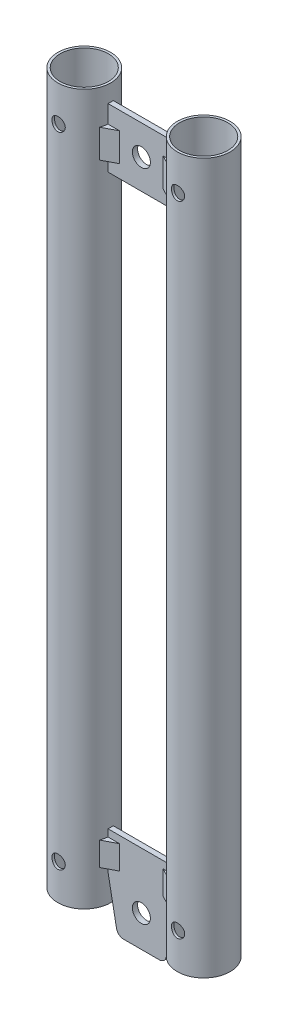
from build123d import *

# Parameters (mm, degrees)
SKETCH1_R                = 3.8
BOSS_EXTRUDE1_DEPTH      = 1.1
SKETCH1_W                = 28
SKETCH1_H                = 25
BOSS_EXTRUDE1_2_DEPTH    = 1.1
BOSS_EXTRUDE2_DEPTH      = 295.2
BOSS_EXTRUDE2_DEPTH_BACK = 3.8
SKETCH2_R                = 11.15
SKETCH2_R_2              = 10.15
SKETCH4_W                = 0.054392761
SKETCH4_H                = 2.2
BOSS_EXTRUDE22_DEPTH     = 16
BOSS_EXTRUDE23_START     = 239.5
SKETCH4_5_W              = 0.054392761
SKETCH4_5_H              = 2.2
BOSS_EXTRUDE23_DEPTH     = 25
BOSS_EXTRUDE24_START     = -13
BOSS_EXTRUDE24_DEPTH     = 10
BOSS_EXTRUDE25_START     = 245
BOSS_EXTRUDE25_DEPTH     = 12
CUT_EXTRUDE1_REACH       = 299.632
CUT_EXTRUDE1_END_RADIUS  = 11.15
SKETCH5_R                = 2.8


# Read off the part's stored shape, not the designer's step: Boss-Extrude24, Boss-Extrude25
with BuildPart() as part:
    # Sketch1 → Boss-Extrude1 (new, symmetric)
    with BuildSketch(Plane.XY):
        with BuildLine():
            Line((-14, 23.7), (14, 23.7))
            Line((14, 23.7), (14, 7.7))
            Line((14, 7.7), (10.464507367, -10.861336324))
            ThreePointArc((10.464507367, -10.861336324), (9.430080362, -12.611277674), (7.517491668, -13.3))
            Line((7.517491668, -13.3), (-7.517491668, -13.3))
            ThreePointArc((-7.517491668, -13.3), (-9.430080362, -12.611277674), (-10.464507367, -10.861336324))
            Line((-10.464507367, -10.861336324), (-14, 7.7))
            Line((-14, 7.7), (-14, 23.7))
        make_face()
        Circle(SKETCH1_R, mode=Mode.SUBTRACT)
    extrude(amount=BOSS_EXTRUDE1_DEPTH, both=True)


with BuildPart() as body_2:
    # Sketch1 → Boss-Extrude1 2 (new, symmetric)
    with BuildSketch(Plane.XY):
        with Locations((0, 275.7)):
            Rectangle(SKETCH1_W, SKETCH1_H)
        with Locations((0, 275.7)):
            Circle(SKETCH1_R, mode=Mode.SUBTRACT)
    extrude(amount=BOSS_EXTRUDE1_2_DEPTH, both=True)


with BuildPart() as body_3:
    # Sketch2 → Boss-Extrude2 (new, two sides: drawn at the far end of the back side and taken through both)
    with BuildSketch(Plane(origin=(0, 0, 0), x_dir=(1, 0, 0), z_dir=(0, 1, 0)).offset(-BOSS_EXTRUDE2_DEPTH_BACK)):
        with Locations(Location((-25.15, 0, 0), (0, 0, 270))):
            Circle(SKETCH2_R)
        with Locations(Location((-25.15, 0, 0), (0, 0, 270))):
            Circle(SKETCH2_R_2, mode=Mode.SUBTRACT)
    extrude(amount=BOSS_EXTRUDE2_DEPTH + BOSS_EXTRUDE2_DEPTH_BACK)

    # Cut-Extrude1: up to this cylinder (the profile starts inside it)
    cut_extrude1_end = Plane(origin=(-25.15, 145.7, 0), z_dir=(0, -1, 0)) * Cylinder(CUT_EXTRUDE1_END_RADIUS, 891.564, mode=Mode.PRIVATE)
    # Sketch5 → Cut-Extrude1 (cut, up to the surface)
    with BuildSketch(Plane.XY, mode=Mode.PRIVATE) as cut_extrude1_sk1:
        with Locations(Location((-25.15, 280.2, 0), (0, 0, 180))):
            Circle(SKETCH5_R)
    cut_extrude1_tool1 = extrude(cut_extrude1_sk1.sketch, amount=CUT_EXTRUDE1_REACH, mode=Mode.PRIVATE) & cut_extrude1_end
    add(cut_extrude1_tool1.solids().sort_by_distance((-25.15, 280.2, 0))[0], mode=Mode.SUBTRACT)
    # Sketch5 → Cut-Extrude1 (cut, up to the surface)
    with BuildSketch(Plane.XY, mode=Mode.PRIVATE) as cut_extrude1_sk2:
        with Locations(Location((-25.15, 11.2, 0), (0, 0, 180))):
            Circle(SKETCH5_R)
    cut_extrude1_tool2 = extrude(cut_extrude1_sk2.sketch, amount=CUT_EXTRUDE1_REACH, mode=Mode.PRIVATE) & cut_extrude1_end
    add(cut_extrude1_tool2.solids().sort_by_distance((-25.15, 11.2, 0))[0], mode=Mode.SUBTRACT)


with BuildPart() as body_4:
    # Sketch4 → Boss-Extrude22 (new body)
    with BuildSketch(Plane(origin=(0, 23.7, 0), x_dir=(1, 0, 0), z_dir=(0, 1, 0))):
        with Locations((-14.027196381, 0)):
            Rectangle(SKETCH4_W, SKETCH4_H)
    extrude(amount=-BOSS_EXTRUDE22_DEPTH)


with BuildPart() as body_5:
    # Sketch4<5> → Boss-Extrude23 (new body)
    with BuildSketch(Plane(origin=(0, 23.7, 0), x_dir=(1, 0, 0), z_dir=(0, 1, 0)).offset(BOSS_EXTRUDE23_START)):
        with Locations((-14.027196381, 0)):
            Rectangle(SKETCH4_5_W, SKETCH4_5_H)
    extrude(amount=BOSS_EXTRUDE23_DEPTH)


with BuildPart() as body_6:
    # Boss-Extrude24 outline → Boss-Extrude24 (new body)
    with BuildSketch(Plane(origin=(0, 23.7, 0), x_dir=(1, 0, 0), z_dir=(0, 1, 0)).offset(BOSS_EXTRUDE24_START)):
        with BuildLine():
            ThreePointArc((-14.154887449, -1.1), (-14.416508117, -2.625766935), (-14.888786621, -4.1))
            Line((-14.888786621, -4.1), (-9.154887449, -1.1))
            Line((-9.154887449, -1.1), (-14.154887449, -1.1))
        make_face()
    extrude(amount=BOSS_EXTRUDE24_DEPTH)


with BuildPart() as body_7:
    # Boss-Extrude25 outline → Boss-Extrude25 (new body)
    with BuildSketch(Plane(origin=(0, 23.7, 0), x_dir=(1, 0, 0), z_dir=(0, 1, 0)).offset(BOSS_EXTRUDE25_START)):
        with BuildLine():
            Line((-9.154887449, -1.1), (-14.154887449, -1.1))
            ThreePointArc((-14.154887449, -1.1), (-14.416508117, -2.625766935), (-14.888786621, -4.1))
            Line((-14.888786621, -4.1), (-9.154887449, -1.1))
        make_face()
    extrude(amount=BOSS_EXTRUDE25_DEPTH)


with BuildPart() as body_8:
    # Mirror18: mirrored copy
    add(body_3.part.mirror(Plane(origin=(0, 0, 0), x_dir=(0, 0, 1), z_dir=(1, 0, 0))))


with BuildPart() as body_9:
    # Mirror18 2: mirrored copy
    add(body_4.part.mirror(Plane(origin=(0, 0, 0), x_dir=(0, 0, 1), z_dir=(1, 0, 0))))


with BuildPart() as body_10:
    # Mirror18 3: mirrored copy
    add(body_5.part.mirror(Plane(origin=(0, 0, 0), x_dir=(0, 0, 1), z_dir=(1, 0, 0))))


with BuildPart() as body_11:
    # Mirror18 4: mirrored copy
    add(body_6.part.mirror(Plane(origin=(0, 0, 0), x_dir=(0, 0, 1), z_dir=(1, 0, 0))))


with BuildPart() as body_12:
    # Mirror18 5: mirrored copy
    add(body_7.part.mirror(Plane(origin=(0, 0, 0), x_dir=(0, 0, 1), z_dir=(1, 0, 0))))


with BuildPart() as body_2_1:
    add(body_2.part)

    # Combine2: union body 3, body 4, body 5, body 6, body 7, body 8, body 9, body 10, body 11, body 12
    add(body_3.part)
    add(body_4.part)
    add(body_5.part)
    add(body_6.part)
    add(body_7.part)
    add(body_8.part)
    add(body_9.part)
    add(body_10.part)
    add(body_11.part)
    add(body_12.part)


solid = Compound([part.part, body_2_1.part])
